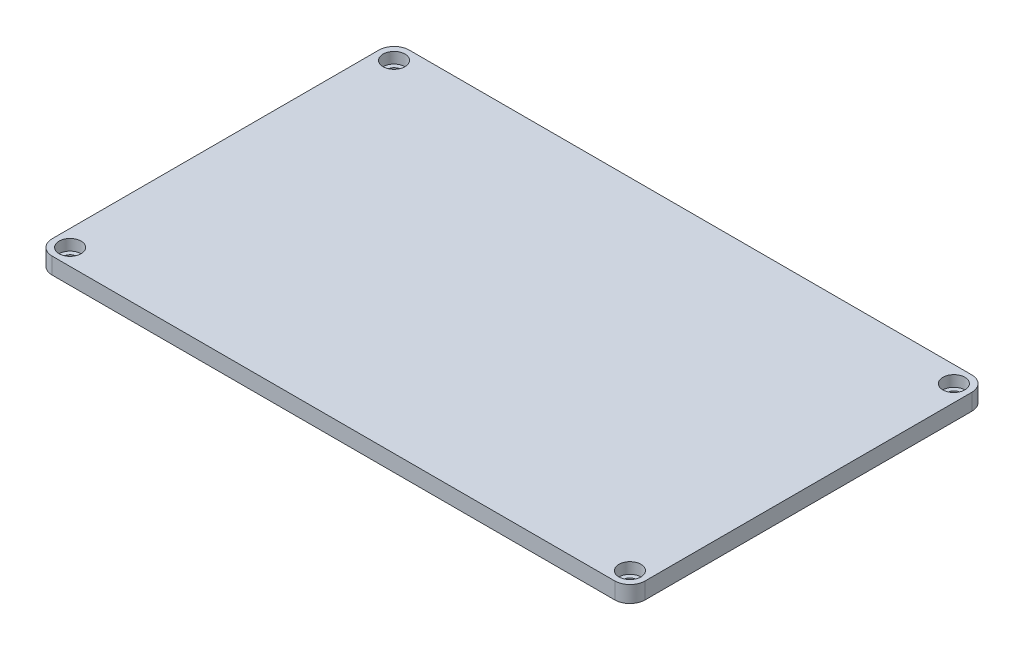
from build123d import *

# Parameters (mm, degrees)
SKETCH1_W                      = 215.9
SKETCH1_H                      = 130
BOSS_EXTRUDE1_DEPTH            = 6
FILLET1_R                      = 5.5118
CAVITY3_DEPTH                  = 3
CBORE_FOR_M4_SHCS1_D           = 4.8
CBORE_FOR_M4_SHCS1_CBORE_D     = 8
CBORE_FOR_M4_SHCS1_CBORE_DEPTH = 4


# Read off the part's stored shape, not the designer's step: Cavity3
with BuildPart() as part:
    # Sketch1 → Boss-Extrude1 (new body)
    with BuildSketch(Plane(origin=(0, 0, 0), x_dir=(1, 0, 0), z_dir=(0, 1, 0))):
        Rectangle(SKETCH1_W, SKETCH1_H)
    extrude(amount=BOSS_EXTRUDE1_DEPTH)

    # Fillet1
    fillet1_edges = [part.edges().sort_by_distance(p)[0] for p in [
        (107.95, 3, 65),
        (-107.95, 3, 65),
        (-107.95, 3, -65),
        (107.95, 3, -65),
    ]]
    fillet(fillet1_edges, radius=FILLET1_R)

    # Cavity3 outline → Cavity3 (cut)
    with BuildSketch(Plane(origin=(0, 0, 0), x_dir=(1, 0, 0), z_dir=(0, 1, 0))):
        with BuildLine():
            ThreePointArc((-106.1, -52.4764), (-105.807106781, -53.183506781), (-105.1, -53.4764))
            Line((-105.1, -53.4764), (-101.9382, -53.4764))
            ThreePointArc((-101.9382, -53.4764), (-98.040768843, -55.090768843), (-96.4264, -58.9882))
            Line((-96.4264, -58.9882), (-96.4264, -62.65))
            ThreePointArc((-96.4264, -62.65), (-96.133506781, -63.357106781), (-95.4264, -63.65))
            Line((-95.4264, -63.65), (95.4264, -63.65))
            ThreePointArc((95.4264, -63.65), (96.133506781, -63.357106781), (96.4264, -62.65))
            Line((96.4264, -62.65), (96.4264, -58.9882))
            ThreePointArc((96.4264, -58.9882), (98.040768843, -55.090768843), (101.9382, -53.4764))
            Line((101.9382, -53.4764), (105.1, -53.4764))
            ThreePointArc((105.1, -53.4764), (105.807106781, -53.183506781), (106.1, -52.4764))
            Line((106.1, -52.4764), (106.1, 52.4764))
            ThreePointArc((106.1, 52.4764), (105.807106781, 53.183506781), (105.1, 53.4764))
            Line((105.1, 53.4764), (104.8, 53.4764))
            Line((104.8, 53.4764), (104.8, -52.4764))
            Line((104.8, -52.4764), (101.4264, -52.4764))
            ThreePointArc((101.4264, -52.4764), (97.183759313, -54.233759313), (95.4264, -58.4764))
            Line((95.4264, -58.4764), (95.4264, -62.35))
            Line((95.4264, -62.35), (-95.4264, -62.35))
            Line((-95.4264, -62.35), (-95.4264, -58.4764))
            ThreePointArc((-95.4264, -58.4764), (-97.183759313, -54.233759313), (-101.4264, -52.4764))
            Line((-101.4264, -52.4764), (-104.8, -52.4764))
            Line((-104.8, -52.4764), (-104.8, 52.4764))
            Line((-104.8, 52.4764), (-101.4264, 52.4764))
            ThreePointArc((-101.4264, 52.4764), (-97.183759313, 54.233759313), (-95.4264, 58.4764))
            Line((-95.4264, 58.4764), (-95.4264, 62.35))
            Line((-95.4264, 62.35), (96.4264, 62.35))
            Line((96.4264, 62.35), (96.4264, 62.65))
            ThreePointArc((96.4264, 62.65), (96.133506781, 63.357106781), (95.4264, 63.65))
            Line((95.4264, 63.65), (-95.4264, 63.65))
            ThreePointArc((-95.4264, 63.65), (-96.133506781, 63.357106781), (-96.4264, 62.65))
            Line((-96.4264, 62.65), (-96.4264, 58.9882))
            ThreePointArc((-96.4264, 58.9882), (-98.040768843, 55.090768843), (-101.9382, 53.4764))
            Line((-101.9382, 53.4764), (-105.1, 53.4764))
            ThreePointArc((-105.1, 53.4764), (-105.807106781, 53.183506781), (-106.1, 52.4764))
            Line((-106.1, 52.4764), (-106.1, -52.4764))
        make_face()
        with BuildLine():
            Line((95.4264, 52.4764), (101.4264, 52.4764))
            ThreePointArc((101.4264, 52.4764), (97.183759313, 54.233759313), (95.4264, 58.4764))
            Line((95.4264, 58.4764), (95.4264, 52.4764))
        make_face()
    extrude(amount=CAVITY3_DEPTH, mode=Mode.SUBTRACT)

    # CBORE for M4 SHCS1 (through all)
    with Locations(Plane(origin=(0, 6, 0), x_dir=(1, 0, 0), z_dir=(0, 1, 0))):
        with Locations((-101.9382, 58.9882), (-101.9382, -58.9882), (101.9382, -58.9882), (101.9382, 58.9882)):
            CounterBoreHole(CBORE_FOR_M4_SHCS1_D / 2, CBORE_FOR_M4_SHCS1_CBORE_D / 2, CBORE_FOR_M4_SHCS1_CBORE_DEPTH)


solid = part.part
